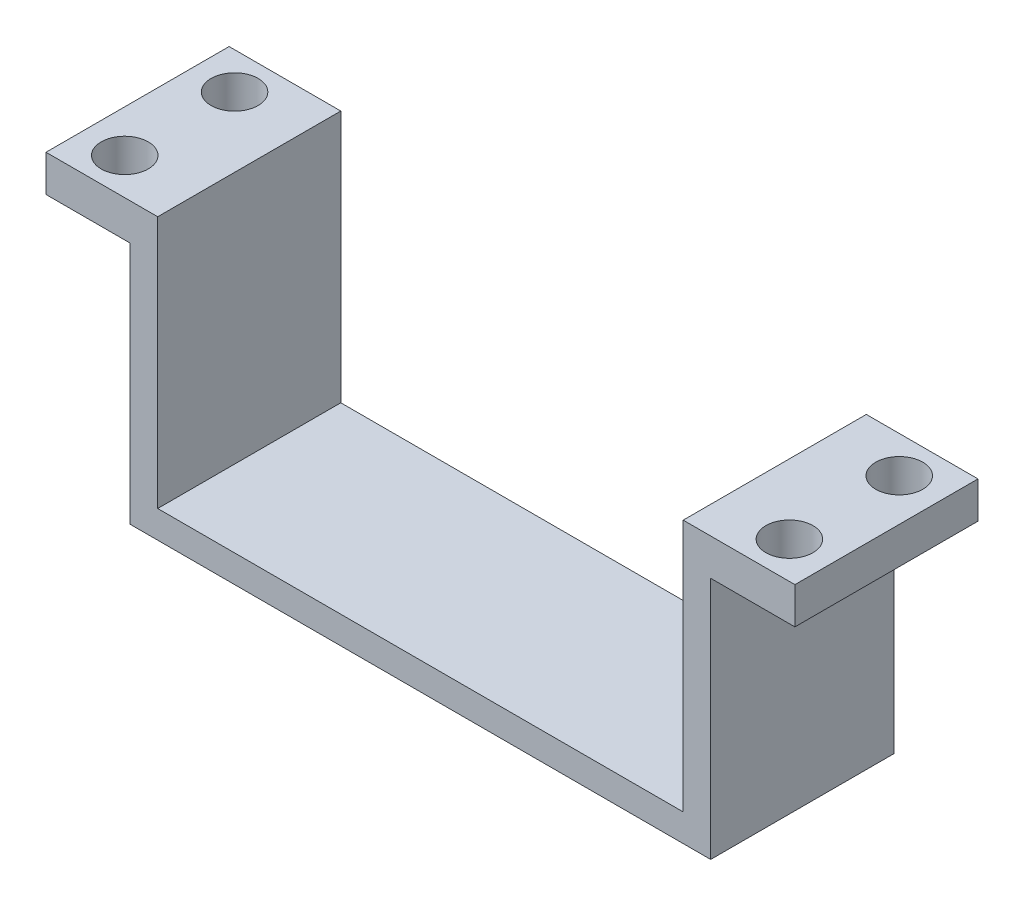
from build123d import *

# Parameters (mm, degrees)
BOSS_EXTRUDE1_DEPTH = 25.4
SKETCH2_W           = 15.494
SKETCH2_H           = 25.4
SKETCH2_R           = 3.2639
BOSS_EXTRUDE2_DEPTH = 5.08


with BuildPart() as part:
    # Sketch1 → Boss-Extrude1 (new body)
    with BuildSketch(Plane.XY):
        Polygon((0, 0), (0, -35.052), (72.898, -35.052), (72.898, 0), (76.708, 0), (76.708, -38.862), (-3.81, -38.862), (-3.81, 0), align=None)
    extrude(amount=BOSS_EXTRUDE1_DEPTH)

    # Sketch2 → Boss-Extrude2 (add)
    with BuildSketch(Plane(origin=(0, 0, 0), x_dir=(1, 0, 0), z_dir=(0, 1, 0))):
        with Locations((-7.747, -12.7)):
            Rectangle(SKETCH2_W, SKETCH2_H)
        with Locations((-9.652, -5.08)):
            Circle(SKETCH2_R, mode=Mode.SUBTRACT)
        with Locations((-9.652, -20.32)):
            Circle(SKETCH2_R, mode=Mode.SUBTRACT)
    boss_extrude2 = extrude(amount=-BOSS_EXTRUDE2_DEPTH)

    # Mirror1: Boss-Extrude2 across plane
    add(boss_extrude2.mirror(Plane(origin=(36.449, 0, 0), x_dir=(0, 0, 1), z_dir=(1, 0, 0))))


solid = part.part
